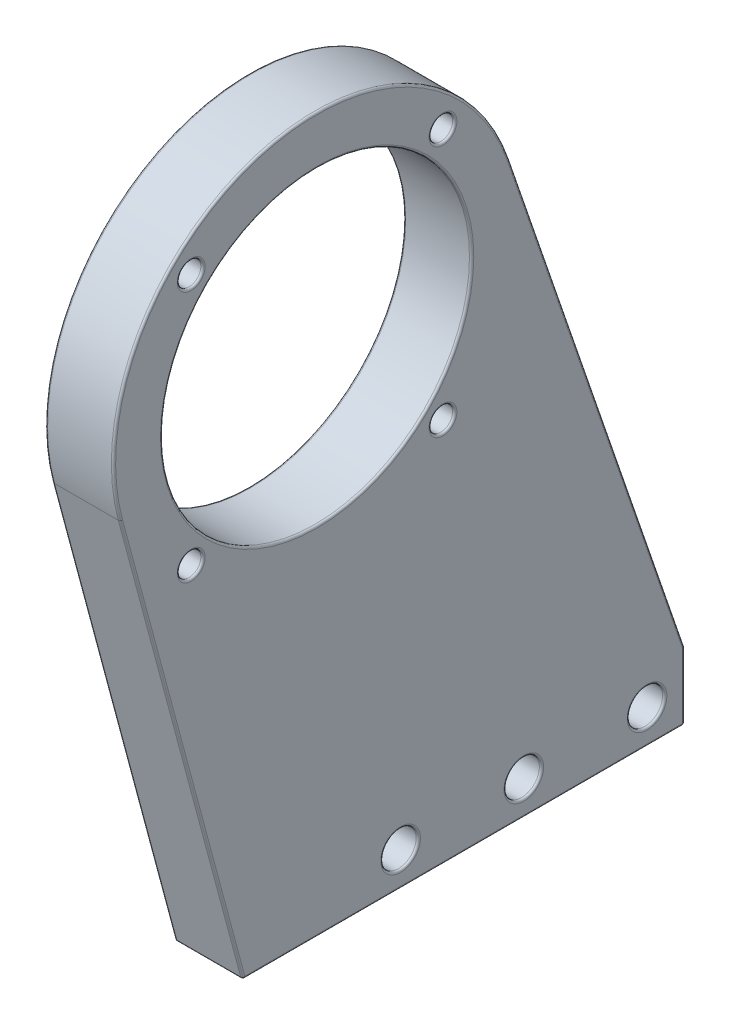
from build123d import *

# Parameters (mm, degrees)
SKETCH1_R           = 38
SKETCH1_R_2         = 2.2
SKETCH1_R_3         = 28.85
SKETCH1_R_4         = 3.3
BOSS_EXTRUDE1_DEPTH = 12.7
CHAMFER1_SIZE       = 3
FILLET1_R           = 0.4


with BuildPart() as part:
    # Sketch1 → Boss-Extrude1 (new body)
    # profile 1 of 2: a face of its own
    with BuildSketch(Plane(origin=(0, 0, 0), x_dir=(0, 0, -1), z_dir=(1, 0, 0))):
        Circle(SKETCH1_R)
        with Locations((23.5, -23.5)):
            Circle(SKETCH1_R_2, mode=Mode.SUBTRACT)
        with Locations((-23.5, -23.5)):
            Circle(SKETCH1_R_2, mode=Mode.SUBTRACT)
        with Locations((23.5, 23.5)):
            Circle(SKETCH1_R_2, mode=Mode.SUBTRACT)
        with Locations((-23.5, 23.5)):
            Circle(SKETCH1_R_2, mode=Mode.SUBTRACT)
        Circle(SKETCH1_R_3, mode=Mode.SUBTRACT)
    # profile 2 of 2: a face of its own
    with BuildSketch(Plane(origin=(0, 0, 0), x_dir=(0, 0, -1), z_dir=(1, 0, 0))):
        with BuildLine():
            ThreePointArc((38, 0), (4.959995304, -37.674904732), (-36.705181399, -9.835123714))
            Line((-36.705181399, -9.835123714), (-13.791539357, -95.35))
            Line((-13.791539357, -95.35), (68.588460643, -95.35))
            Line((68.588460643, -95.35), (68.588460643, -82.65))
            Line((68.588460643, -82.65), (35.936663125, 12.351366055))
            ThreePointArc((35.936663125, 12.351366055), (37.480616315, 6.261261903), (38, 0))
        make_face()
        with Locations((15.59, -89)):
            Circle(SKETCH1_R_4, mode=Mode.SUBTRACT)
        with Locations((38.59, -89)):
            Circle(SKETCH1_R_4, mode=Mode.SUBTRACT)
        with Locations((61.59, -89)):
            Circle(SKETCH1_R_4, mode=Mode.SUBTRACT)
    extrude(amount=BOSS_EXTRUDE1_DEPTH)

    # Chamfer1
    chamfer1_edges = [part.edges().sort_by_distance(p)[0] for p in [
        (0, -89, -58.29),
        (0, -89, -35.29),
        (0, -89, -12.29),
    ]]
    chamfer(chamfer1_edges, length=CHAMFER1_SIZE)

    # Fillet1
    # the kernel refuses this fillet: 0.4 mm, written as the material it takes off along each edge
    with BuildSketch(Plane(origin=(12.3, -82.716821333, -68.188460643), x_dir=(0, 0, -1), z_dir=(1, 0, 0))) as fillet1_piece_1_section:
        Polygon((0, 0), (FILLET1_R * 1.02, 0), (FILLET1_R * 1.02, FILLET1_R * 0.170394400329), (FILLET1_R * 0.964615694418, FILLET1_R * 0.331536667779), align=None)
    fillet1_piece_1 = extrude(amount=FILLET1_R * 1.02, mode=Mode.PRIVATE)
    fillet1_piece_1 = fillet1_piece_1 - Plane(origin=(12.3, -82.716821333, -68.188460643), x_dir=(0, -0.16477005007846748, 0.9863320083000142), z_dir=(1, 0, 0)) * Sphere(FILLET1_R, mode=Mode.PRIVATE)
    add(fillet1_piece_1, mode=Mode.SUBTRACT)
    with BuildSketch(Plane(origin=(0.4, -94.95, -68.188460643), x_dir=(0, -1, 0), z_dir=(-1, 0, 0))) as fillet1_piece_2_section:
        Polygon((0, 0), (FILLET1_R * 1.02, 0), (FILLET1_R * 1.02, -FILLET1_R * 1.02), (0, -FILLET1_R * 1.02), align=None)
    fillet1_piece_2 = extrude(amount=FILLET1_R * 1.02, mode=Mode.PRIVATE)
    fillet1_piece_2 = fillet1_piece_2 - Plane(origin=(0.4, -94.95, -68.188460643), x_dir=(0, 0.7071067811865476, 0.7071067811865475), z_dir=(-1, 0, 0)) * Sphere(FILLET1_R, mode=Mode.PRIVATE)
    add(fillet1_piece_2, mode=Mode.SUBTRACT)
    with BuildSketch(Plane(origin=(0.4, -82.716821333, -68.188460643), x_dir=(0, 0, -1), z_dir=(-1, 0, 0))) as fillet1_piece_3_section:
        Polygon((0, 0), (FILLET1_R * 1.02, 0), (FILLET1_R * 1.02, -FILLET1_R * 0.170394400329), (FILLET1_R * 0.964615694418, -FILLET1_R * 0.331536667779), align=None)
    fillet1_piece_3 = extrude(amount=FILLET1_R * 1.02, mode=Mode.PRIVATE)
    fillet1_piece_3 = fillet1_piece_3 - Plane(origin=(0.4, -82.716821333, -68.188460643), x_dir=(0, -0.16477005007846748, 0.9863320083000142), z_dir=(-1, 0, 0)) * Sphere(FILLET1_R, mode=Mode.PRIVATE)
    add(fillet1_piece_3, mode=Mode.SUBTRACT)
    with BuildSketch(Plane(origin=(0.4, -94.95, 13.484608562), x_dir=(0, -0.25881904510251824, 0.9659258262890691), z_dir=(-1, 0, 0))) as fillet1_piece_4_section:
        Polygon((0, 0), (FILLET1_R * 1.02, 0), (FILLET1_R * 1.02, -FILLET1_R * 0.782673527739), (FILLET1_R * 0.263995426005, -FILLET1_R * 0.985244342815), align=None)
    fillet1_piece_4 = extrude(amount=FILLET1_R * 1.02, mode=Mode.PRIVATE)
    fillet1_piece_4 = fillet1_piece_4 - Plane(origin=(0.4, -94.95, 13.484608562), x_dir=(0, 0.7933533402912343, -0.6087614290087218), z_dir=(-1, 0, 0)) * Sphere(FILLET1_R, mode=Mode.PRIVATE)
    add(fillet1_piece_4, mode=Mode.SUBTRACT)
    with BuildSketch(Plane(origin=(12.3, -94.95, 13.484608562), x_dir=(0, -0.25881904510251824, 0.9659258262890691), z_dir=(1, 0, 0))) as fillet1_piece_5_section:
        Polygon((0, 0), (FILLET1_R * 1.02, 0), (FILLET1_R * 1.02, FILLET1_R * 0.782673527739), (FILLET1_R * 0.263995426005, FILLET1_R * 0.985244342815), align=None)
    fillet1_piece_5 = extrude(amount=FILLET1_R * 1.02, mode=Mode.PRIVATE)
    fillet1_piece_5 = fillet1_piece_5 - Plane(origin=(12.3, -94.95, 13.484608562), x_dir=(0, 0.7933533402912343, -0.6087614290087218), z_dir=(1, 0, 0)) * Sphere(FILLET1_R, mode=Mode.PRIVATE)
    add(fillet1_piece_5, mode=Mode.SUBTRACT)
    with BuildSketch(Plane(origin=(12.3, -94.95, -68.188460643), x_dir=(0, 0, -1), z_dir=(0, -1, 0))) as fillet1_piece_6_section:
        Polygon((0, 0), (FILLET1_R * 1.02, 0), (FILLET1_R * 1.02, FILLET1_R * 1.02), (0, FILLET1_R * 1.02), align=None)
    fillet1_piece_6 = extrude(amount=FILLET1_R * 1.02, mode=Mode.PRIVATE)
    fillet1_piece_6 = fillet1_piece_6 - Plane(origin=(12.3, -94.95, -68.188460643), x_dir=(-0.7071067811865475, 0, 0.7071067811865475), z_dir=(0, -1, 0)) * Sphere(FILLET1_R, mode=Mode.PRIVATE)
    add(fillet1_piece_6, mode=Mode.SUBTRACT)
    with BuildSketch(Plane(origin=(12.7, -82.586806954, -68.566741307), x_dir=(-1, 0, 0), z_dir=(0, 0.9457016611942787, 0.3250359488031775)), Plane(origin=(0, -82.586806954, -68.566741307), x_dir=(0, -0.3250359488031775, 0.9457016611942787), z_dir=(0, 0.9457016611942787, 0.3250359488031775))) as fillet1_piece_7:
        with BuildLine():
            CenterArc((FILLET1_R, FILLET1_R), FILLET1_R, 180, 90)
            Line((0, FILLET1_R), (0, 0))
            Line((0, 0), (FILLET1_R, 0))
        make_face()
    extrude(amount=100.389136346, mode=Mode.SUBTRACT)
    with BuildSketch(Plane(origin=(12.7, 0, 0), x_dir=(0, 0.3250359488031776, -0.9457016611942786), z_dir=(0, -0.9457016611942786, -0.3250359488031776))) as fillet1_piece_8:
        with BuildLine():
            CenterArc((38 - FILLET1_R, -FILLET1_R), FILLET1_R, 0, 90)
            Line((38 - FILLET1_R, 0), (38, 0))
            Line((38, 0), (38, -FILLET1_R))
        make_face()
    revolve(axis=Axis((12.7, 0, 0), (1, 0, 0)), revolution_arc=176.03224705, mode=Mode.SUBTRACT)
    with BuildSketch(Plane(origin=(0, 0, 0), x_dir=(0, 0, -1), z_dir=(0, -1, 0))) as fillet1_piece_9:
        with BuildLine():
            CenterArc((28.85 + FILLET1_R, FILLET1_R), FILLET1_R, 180, 90)
            Line((28.85, FILLET1_R), (28.85, 0))
            Line((28.85, 0), (28.85 + FILLET1_R, 0))
        make_face()
    revolve(axis=Axis((0, 0, 0), (1, 0, 0)), mode=Mode.SUBTRACT)
    with BuildSketch(Plane(origin=(0, 23.5, 23.5), x_dir=(0, 0, -1), z_dir=(0, -1, 0))) as fillet1_piece_10:
        with BuildLine():
            CenterArc((2.2 + FILLET1_R, FILLET1_R), FILLET1_R, 180, 90)
            Line((2.2, FILLET1_R), (2.2, 0))
            Line((2.2, 0), (2.2 + FILLET1_R, 0))
        make_face()
    revolve(axis=Axis((0, 23.5, 23.5), (1, 0, 0)), mode=Mode.SUBTRACT)
    with BuildSketch(Plane(origin=(0, 23.5, -23.5), x_dir=(0, 0, -1), z_dir=(0, -1, 0))) as fillet1_piece_11:
        with BuildLine():
            CenterArc((2.2 + FILLET1_R, FILLET1_R), FILLET1_R, 180, 90)
            Line((2.2, FILLET1_R), (2.2, 0))
            Line((2.2, 0), (2.2 + FILLET1_R, 0))
        make_face()
    revolve(axis=Axis((0, 23.5, -23.5), (1, 0, 0)), mode=Mode.SUBTRACT)
    with BuildSketch(Plane(origin=(0, -23.5, 23.5), x_dir=(0, 0, -1), z_dir=(0, -1, 0))) as fillet1_piece_12:
        with BuildLine():
            CenterArc((2.2 + FILLET1_R, FILLET1_R), FILLET1_R, 180, 90)
            Line((2.2, FILLET1_R), (2.2, 0))
            Line((2.2, 0), (2.2 + FILLET1_R, 0))
        make_face()
    revolve(axis=Axis((0, -23.5, 23.5), (1, 0, 0)), mode=Mode.SUBTRACT)
    with BuildSketch(Plane(origin=(0, -23.5, -23.5), x_dir=(0, 0, -1), z_dir=(0, -1, 0))) as fillet1_piece_13:
        with BuildLine():
            CenterArc((2.2 + FILLET1_R, FILLET1_R), FILLET1_R, 180, 90)
            Line((2.2, FILLET1_R), (2.2, 0))
            Line((2.2, 0), (2.2 + FILLET1_R, 0))
        make_face()
    revolve(axis=Axis((0, -23.5, -23.5), (1, 0, 0)), mode=Mode.SUBTRACT)
    with BuildSketch(Plane(origin=(0, -94.95, -68.588460643), x_dir=(0, 0, 1), z_dir=(0, 1, 0)), Plane(origin=(12.7, -94.95, -68.588460643), x_dir=(-1, 0, 0), z_dir=(0, 1, 0))) as fillet1_piece_14:
        with BuildLine():
            CenterArc((FILLET1_R, FILLET1_R), FILLET1_R, 180, 90)
            Line((0, FILLET1_R), (0, 0))
            Line((0, 0), (FILLET1_R, 0))
        make_face()
    extrude(amount=12.233178667, mode=Mode.SUBTRACT)
    with BuildSketch(Plane(origin=(0, -95.35, 13.484608562), x_dir=(0, 1, 0), z_dir=(0, 0, -1)), Plane(origin=(12.7, -95.35, 13.484608562), x_dir=(-1, 0, 0), z_dir=(0, 0, -1))) as fillet1_piece_15:
        with BuildLine():
            CenterArc((FILLET1_R, FILLET1_R), FILLET1_R, 180, 90)
            Line((0, FILLET1_R), (0, 0))
            Line((0, 0), (FILLET1_R, 0))
        make_face()
    extrude(amount=81.673069205, mode=Mode.SUBTRACT)
    with BuildSketch(Plane(origin=(0, -9.835123714, 36.705181399), x_dir=(0, 0.25881904510251824, -0.965925826289069), z_dir=(0, -0.9659258262890691, -0.25881904510251824)), Plane(origin=(12.7, -9.835123714, 36.705181399), x_dir=(-1, 0, 0), z_dir=(0, -0.9659258262890691, -0.25881904510251824))) as fillet1_piece_16:
        with BuildLine():
            CenterArc((FILLET1_R, FILLET1_R), FILLET1_R, 180, 90)
            Line((0, FILLET1_R), (0, 0))
            Line((0, 0), (FILLET1_R, 0))
        make_face()
    extrude(amount=88.224583695, mode=Mode.SUBTRACT)
    with BuildSketch(Plane(origin=(0, 0, 0), x_dir=(0, 0.3250359488031776, -0.9457016611942786), z_dir=(0, -0.9457016611942786, -0.3250359488031776))) as fillet1_piece_17:
        with BuildLine():
            CenterArc((38 - FILLET1_R, FILLET1_R), FILLET1_R, 270, 90)
            Line((38, FILLET1_R), (38, 0))
            Line((38, 0), (38 - FILLET1_R, 0))
        make_face()
    revolve(axis=Axis((0, 0, 0), (1, 0, 0)), revolution_arc=176.03224705, mode=Mode.SUBTRACT)
    with BuildSketch(Plane(origin=(0.4, -82.65, -68.588460643), x_dir=(0, -1, 0), z_dir=(1, 0, 0))) as fillet1_piece_18:
        with BuildLine():
            CenterArc((FILLET1_R * 0.167053333656, -FILLET1_R), FILLET1_R, 90, 18.96775295)
            Line((-FILLET1_R * 0.157982615147, -FILLET1_R * 0.0542983388057), (0, 0))
            Line((0, 0), (FILLET1_R * 0.167053333656, 0))
        make_face()
    extrude(amount=11.9, mode=Mode.SUBTRACT)
    with BuildSketch(Plane(origin=(0.4, -95.35, -68.588460643), x_dir=(0, 0, 1), z_dir=(1, 0, 0))) as fillet1_piece_19:
        with BuildLine():
            CenterArc((FILLET1_R, -FILLET1_R), FILLET1_R, 90, 90)
            Line((0, -FILLET1_R), (0, 0))
            Line((0, 0), (FILLET1_R, 0))
        make_face()
    extrude(amount=11.9, mode=Mode.SUBTRACT)
    with BuildSketch(Plane(origin=(0.4, -95.35, 13.791539357), x_dir=(0, 0.9659258262890705, 0.25881904510251247), z_dir=(1, 0, 0))) as fillet1_piece_20:
        with BuildLine():
            CenterArc((FILLET1_R * 0.767326987979, -FILLET1_R), FILLET1_R, 90, 75)
            Line((-FILLET1_R * 0.19859883831, -FILLET1_R * 0.741180954897), (0, 0))
            Line((0, 0), (FILLET1_R * 0.767326987979, 0))
        make_face()
    extrude(amount=11.9, mode=Mode.SUBTRACT)
    with BuildSketch(Plane(origin=(12.7, -23.5, -23.5), x_dir=(0, 0, -1), z_dir=(0, -1, 0))) as fillet1_piece_21:
        with BuildLine():
            CenterArc((2.2 + FILLET1_R, -FILLET1_R), FILLET1_R, 90, 90)
            Line((2.2 + FILLET1_R, 0), (2.2, 0))
            Line((2.2, 0), (2.2, -FILLET1_R))
        make_face()
    revolve(axis=Axis((12.7, -23.5, -23.5), (1, 0, 0)), mode=Mode.SUBTRACT)
    with BuildSketch(Plane(origin=(12.7, -23.5, 23.5), x_dir=(0, 0, -1), z_dir=(0, -1, 0))) as fillet1_piece_22:
        with BuildLine():
            CenterArc((2.2 + FILLET1_R, -FILLET1_R), FILLET1_R, 90, 90)
            Line((2.2 + FILLET1_R, 0), (2.2, 0))
            Line((2.2, 0), (2.2, -FILLET1_R))
        make_face()
    revolve(axis=Axis((12.7, -23.5, 23.5), (1, 0, 0)), mode=Mode.SUBTRACT)
    with BuildSketch(Plane(origin=(0, -89, -61.59), x_dir=(0, 0, -1), z_dir=(0, -1, 0))) as fillet1_piece_23:
        with BuildLine():
            CenterArc((6.3 + FILLET1_R * 0.414213562373, FILLET1_R), FILLET1_R, 225, 45)
            Line((6.3 - FILLET1_R * 0.292893218813, FILLET1_R * 0.292893218813), (6.3, 0))
            Line((6.3, 0), (6.3 + FILLET1_R * 0.414213562373, 0))
        make_face()
    revolve(axis=Axis((0, -89, -61.59), (1, 0, 0)), mode=Mode.SUBTRACT)
    with BuildSketch(Plane(origin=(0, -89, -38.59), x_dir=(0, 0, -1), z_dir=(0, -1, 0))) as fillet1_piece_24:
        with BuildLine():
            CenterArc((6.3 + FILLET1_R * 0.414213562373, FILLET1_R), FILLET1_R, 225, 45)
            Line((6.3 - FILLET1_R * 0.292893218813, FILLET1_R * 0.292893218813), (6.3, 0))
            Line((6.3, 0), (6.3 + FILLET1_R * 0.414213562373, 0))
        make_face()
    revolve(axis=Axis((0, -89, -38.59), (1, 0, 0)), mode=Mode.SUBTRACT)
    with BuildSketch(Plane(origin=(12.7, 23.5, -23.5), x_dir=(0, 0, -1), z_dir=(0, -1, 0))) as fillet1_piece_25:
        with BuildLine():
            CenterArc((2.2 + FILLET1_R, -FILLET1_R), FILLET1_R, 90, 90)
            Line((2.2 + FILLET1_R, 0), (2.2, 0))
            Line((2.2, 0), (2.2, -FILLET1_R))
        make_face()
    revolve(axis=Axis((12.7, 23.5, -23.5), (1, 0, 0)), mode=Mode.SUBTRACT)
    with BuildSketch(Plane(origin=(0, -89, -15.59), x_dir=(0, 0, -1), z_dir=(0, -1, 0))) as fillet1_piece_26:
        with BuildLine():
            CenterArc((6.3 + FILLET1_R * 0.414213562373, FILLET1_R), FILLET1_R, 225, 45)
            Line((6.3 - FILLET1_R * 0.292893218813, FILLET1_R * 0.292893218813), (6.3, 0))
            Line((6.3, 0), (6.3 + FILLET1_R * 0.414213562373, 0))
        make_face()
    revolve(axis=Axis((0, -89, -15.59), (1, 0, 0)), mode=Mode.SUBTRACT)
    with BuildSketch(Plane(origin=(3, -89, -15.59), x_dir=(0, 0, -1), z_dir=(0, -1, 0))) as fillet1_piece_27:
        with BuildLine():
            CenterArc((3.3 + FILLET1_R, FILLET1_R * 0.414213562373), FILLET1_R, 180, 45)
            Line((3.3, FILLET1_R * 0.414213562373), (3.3, 0))
            Line((3.3, 0), (3.3 + FILLET1_R * 0.292893218813, -FILLET1_R * 0.292893218813))
        make_face()
    revolve(axis=Axis((3, -89, -15.59), (1, 0, 0)), mode=Mode.SUBTRACT)
    with BuildSketch(Plane(origin=(3, -89, -38.59), x_dir=(0, 0, -1), z_dir=(0, -1, 0))) as fillet1_piece_28:
        with BuildLine():
            CenterArc((3.3 + FILLET1_R, FILLET1_R * 0.414213562373), FILLET1_R, 180, 45)
            Line((3.3, FILLET1_R * 0.414213562373), (3.3, 0))
            Line((3.3, 0), (3.3 + FILLET1_R * 0.292893218813, -FILLET1_R * 0.292893218813))
        make_face()
    revolve(axis=Axis((3, -89, -38.59), (1, 0, 0)), mode=Mode.SUBTRACT)
    with BuildSketch(Plane(origin=(3, -89, -61.59), x_dir=(0, 0, -1), z_dir=(0, -1, 0))) as fillet1_piece_29:
        with BuildLine():
            CenterArc((3.3 + FILLET1_R, FILLET1_R * 0.414213562373), FILLET1_R, 180, 45)
            Line((3.3, FILLET1_R * 0.414213562373), (3.3, 0))
            Line((3.3, 0), (3.3 + FILLET1_R * 0.292893218813, -FILLET1_R * 0.292893218813))
        make_face()
    revolve(axis=Axis((3, -89, -61.59), (1, 0, 0)), mode=Mode.SUBTRACT)
    with BuildSketch(Plane(origin=(12.7, 23.5, 23.5), x_dir=(0, 0, -1), z_dir=(0, -1, 0))) as fillet1_piece_30:
        with BuildLine():
            CenterArc((2.2 + FILLET1_R, -FILLET1_R), FILLET1_R, 90, 90)
            Line((2.2 + FILLET1_R, 0), (2.2, 0))
            Line((2.2, 0), (2.2, -FILLET1_R))
        make_face()
    revolve(axis=Axis((12.7, 23.5, 23.5), (1, 0, 0)), mode=Mode.SUBTRACT)
    with BuildSketch(Plane(origin=(12.7, 0, 0), x_dir=(0, 0, -1), z_dir=(0, -1, 0))) as fillet1_piece_31:
        with BuildLine():
            CenterArc((28.85 + FILLET1_R, -FILLET1_R), FILLET1_R, 90, 90)
            Line((28.85 + FILLET1_R, 0), (28.85, 0))
            Line((28.85, 0), (28.85, -FILLET1_R))
        make_face()
    revolve(axis=Axis((12.7, 0, 0), (1, 0, 0)), mode=Mode.SUBTRACT)
    with BuildSketch(Plane(origin=(12.7, -89, -15.59), x_dir=(0, 0, -1), z_dir=(0, -1, 0))) as fillet1_piece_32:
        with BuildLine():
            CenterArc((3.3 + FILLET1_R, -FILLET1_R), FILLET1_R, 90, 90)
            Line((3.3, -FILLET1_R), (3.3, 0))
            Line((3.3, 0), (3.3 + FILLET1_R, 0))
        make_face()
    revolve(axis=Axis((12.7, -89, -15.59), (1, 0, 0)), mode=Mode.SUBTRACT)
    with BuildSketch(Plane(origin=(12.7, -89, -38.59), x_dir=(0, 0, -1), z_dir=(0, -1, 0))) as fillet1_piece_33:
        with BuildLine():
            CenterArc((3.3 + FILLET1_R, -FILLET1_R), FILLET1_R, 90, 90)
            Line((3.3, -FILLET1_R), (3.3, 0))
            Line((3.3, 0), (3.3 + FILLET1_R, 0))
        make_face()
    revolve(axis=Axis((12.7, -89, -38.59), (1, 0, 0)), mode=Mode.SUBTRACT)
    with BuildSketch(Plane(origin=(12.7, -89, -61.59), x_dir=(0, 0, -1), z_dir=(0, -1, 0))) as fillet1_piece_34:
        with BuildLine():
            CenterArc((3.3 + FILLET1_R, -FILLET1_R), FILLET1_R, 90, 90)
            Line((3.3 + FILLET1_R, 0), (3.3, 0))
            Line((3.3, 0), (3.3, -FILLET1_R))
        make_face()
    revolve(axis=Axis((12.7, -89, -61.59), (1, 0, 0)), mode=Mode.SUBTRACT)


solid = part.part
